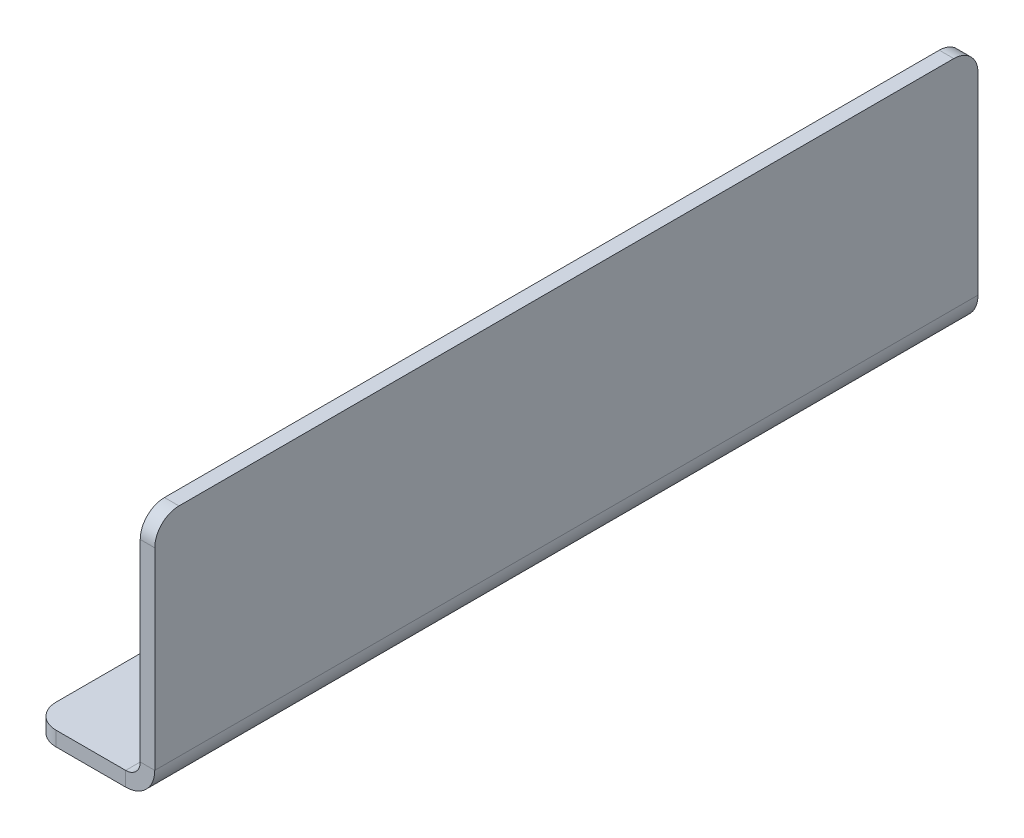
from build123d import *

# Parameters (mm, degrees)
BASE_FLANGE1_DEPTH           = 170
F_30_0_1285_DIAMETER_HOLE1_D = 3.2639
FILLET1_R                    = 5


# Sheet-metal steps are written as plain solids
with BuildPart() as part:
    # Sketch1 → Base-Flange1 (new body)
    with BuildSketch(Plane.XY):
        with BuildLine():
            Line((-25.4, 0), (-6, 0))
            ThreePointArc((-6, 0), (-1.757359313, 1.757359313), (0, 6))
            Line((0, 6), (0, 50.8))
            Line((0, 50.8), (-3, 50.8))
            Line((-3, 50.8), (-3, 6))
            ThreePointArc((-3, 6), (-3.878679656, 3.878679656), (-6, 3))
            Line((-6, 3), (-25.4, 3))
            Line((-25.4, 3), (-25.4, 0))
        make_face()
    extrude(amount=BASE_FLANGE1_DEPTH)

    # #30 (0.1285) Diameter Hole1 (through all)
    with Locations(Plane(origin=(0, 3, 0), x_dir=(1, 0, 0), z_dir=(0, 1, 0))):
        with Locations((-15.7, -25), (-15.7, -75), (-15.7, -125)):
            Hole(F_30_0_1285_DIAMETER_HOLE1_D / 2)

    # Fillet1
    fillet1_edges = [part.edges().sort_by_distance(p)[0] for p in [
        (-1.5, 50.8, 170),
        (-1.5, 50.8, 0),
        (-25.4, 1.5, 170),
        (-25.4, 1.5, 0),
    ]]
    fillet(fillet1_edges, radius=FILLET1_R)


solid = part.part
